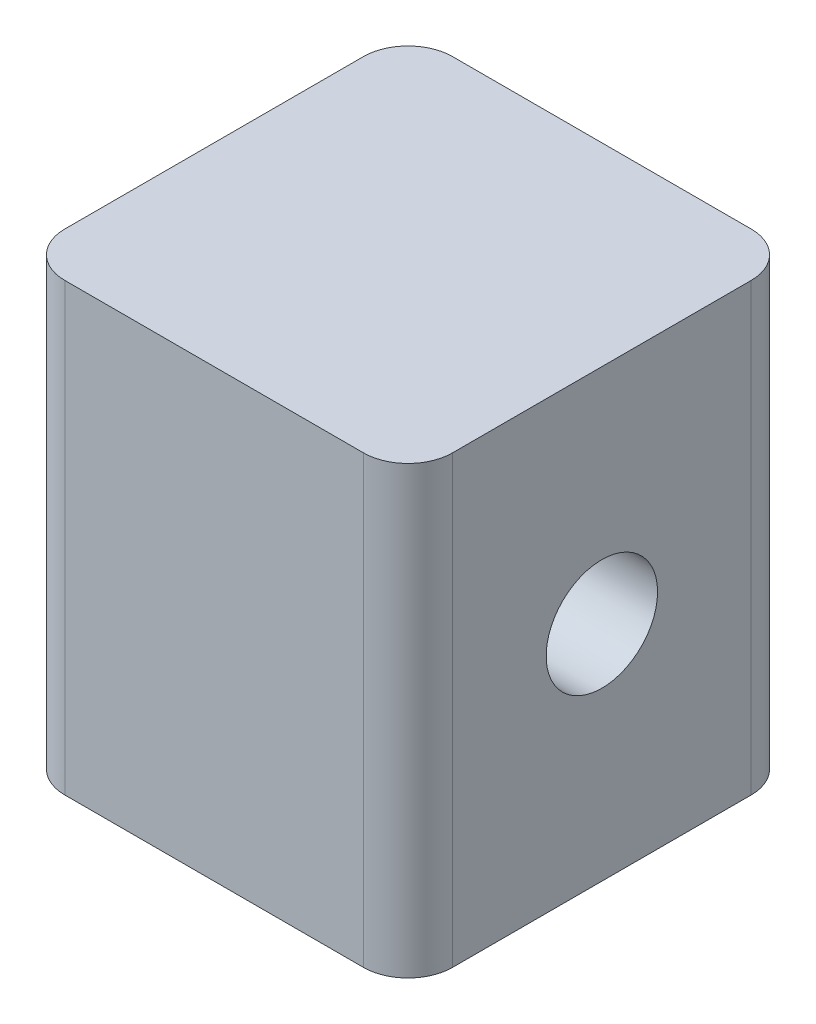
from build123d import *

# Parameters (mm, degrees)
SKETCH4_W           = 22.098
SKETCH4_H           = 22.098
BOSS_EXTRUDE2_DEPTH = 12.7
FILLET1_R           = 2.54
SKETCH6_R           = 3.175
CUT_EXTRUDE1_DEPTH  = 28.779344935


with BuildPart() as part:
    # Sketch4 → Boss-Extrude2 (new, symmetric)
    with BuildSketch(Plane(origin=(0, 0, 0), x_dir=(1, 0, 0), z_dir=(0, 1, 0))):
        Rectangle(SKETCH4_W, SKETCH4_H)
    extrude(amount=BOSS_EXTRUDE2_DEPTH, both=True)

    # Fillet1
    fillet1_edges = [part.edges().sort_by_distance(p)[0] for p in [
        (-11.049, 0, 11.049),
        (11.049, 0, 11.049),
        (11.049, 0, -11.049),
        (-11.049, 0, -11.049),
    ]]
    fillet(fillet1_edges, radius=FILLET1_R)

    # Sketch6 → Cut-Extrude1 (cut, through all)
    with BuildSketch(Plane(origin=(11.049, 0, 0), x_dir=(0, 0, -1), z_dir=(1, 0, 0))):
        Circle(SKETCH6_R)
    extrude(amount=-CUT_EXTRUDE1_DEPTH, mode=Mode.SUBTRACT)


solid = part.part
